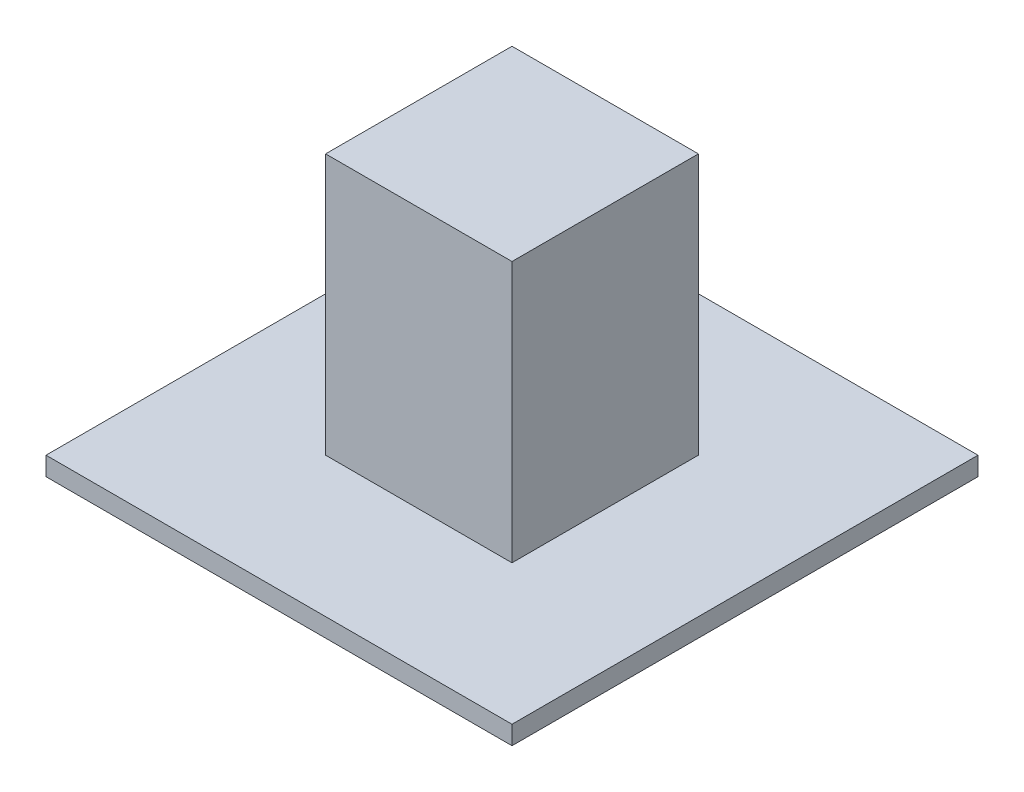
from build123d import *

# Parameters (mm, degrees)
SKETCH1_W           = 2
SKETCH1_H           = 2
BOSS_EXTRUDE1_DEPTH = 2.8
SKETCH2_W           = 5
SKETCH2_H           = 5
BOSS_EXTRUDE2_DEPTH = 0.2
SKETCH3_R           = 0.5
BOSS_EXTRUDE3_DEPTH = 1


with BuildPart() as part:
    # Sketch1 → Boss-Extrude1 (new body)
    with BuildSketch(Plane(origin=(0, 0, 0), x_dir=(1, 0, 0), z_dir=(0, 1, 0))):
        Rectangle(SKETCH1_W, SKETCH1_H)
    extrude(amount=BOSS_EXTRUDE1_DEPTH)

    # Sketch2 → Boss-Extrude2 (add)
    with BuildSketch(Plane(origin=(0, 0, 0), x_dir=(1, 0, 0), z_dir=(0, 1, 0))):
        Rectangle(SKETCH2_W, SKETCH2_H)
    extrude(amount=-BOSS_EXTRUDE2_DEPTH)

    # Sketch3 → Boss-Extrude3 (add)
    with BuildSketch(Plane(origin=(0, -0.2, 0), x_dir=(-1, 0, 0), z_dir=(0, -1, 0))):
        Circle(SKETCH3_R)
    extrude(amount=BOSS_EXTRUDE3_DEPTH)


solid = part.part
